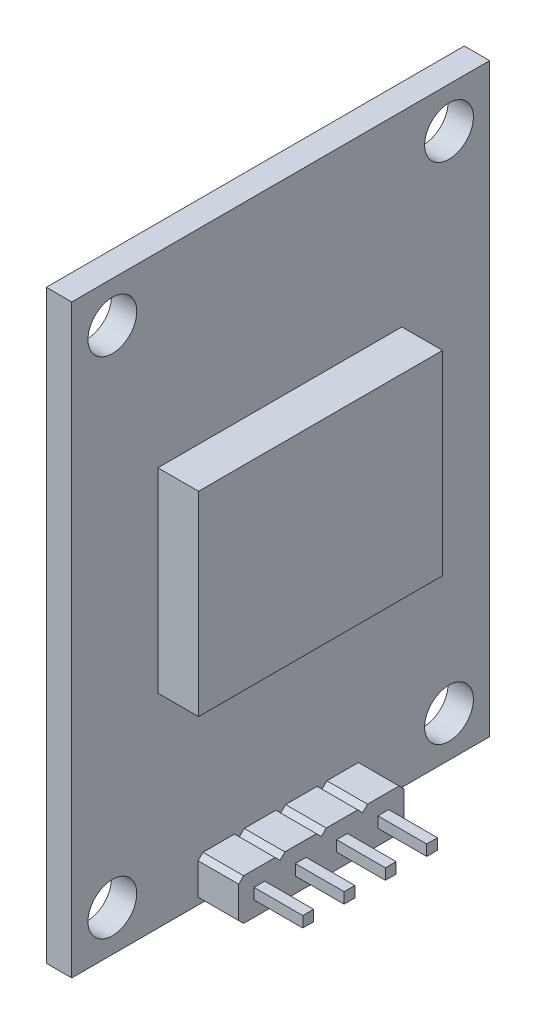
from build123d import *

# Parameters (mm, degrees)
SKETCH_1_W             = 25.7
SKETCH_1_H             = 36
EXTRUDE_1_DEPTH        = 1.56
SKETCH_2_R             = 1.5
CUT_EXTRUDE_1_DEPTH    = 1.56
SKETCH_3_W             = 2.54
SKETCH_3_H             = 2.54
EXTRUDE_2_DEPTH        = 2.5
CHAMFER_1_SIZE         = 0.3
PATTERN_START          = 1.56
PATTERN_LINEAR_1_DEPTH = 2.5
SKETCH_4_W             = 15
SKETCH_4_H             = 12
EXTRUDE_3_DEPTH        = 2.5
SKETCH_5_W             = 0.664657546
SKETCH_5_H             = 0.664657545
EXTRUDE_4_DEPTH        = 3
PATTERN_LINEAR_2_COUNT = 4
PATTERN_LINEAR_2_PITCH = 2.54


# Read off the part's stored shape, not the designer's step: 阵列(线性)1
with BuildPart() as part:
    # 草图1 → 凸台-拉伸1 (new body)
    with BuildSketch(Plane(origin=(0, 0, 0), x_dir=(0, 0, -1), z_dir=(1, 0, 0))):
        Rectangle(SKETCH_1_W, SKETCH_1_H)
    extrude(amount=EXTRUDE_1_DEPTH)

    # 草图2 → 切除-拉伸1 (cut)
    with BuildSketch(Plane(origin=(1.56, 0, 0), x_dir=(0, 0, -1), z_dir=(1, 0, 0))):
        with Locations((-10.35, 15.5)):
            Circle(SKETCH_2_R)
        with Locations((10.35, 15.5)):
            Circle(SKETCH_2_R)
        with Locations((-10.35, -15.5)):
            Circle(SKETCH_2_R)
        with Locations((10.35, -15.5)):
            Circle(SKETCH_2_R)
    extrude(amount=-CUT_EXTRUDE_1_DEPTH, mode=Mode.SUBTRACT)

    # 草图3 → 凸台-拉伸2 (add)
    with BuildSketch(Plane(origin=(1.56, 0, 0), x_dir=(0, 0, -1), z_dir=(1, 0, 0))):
        with Locations((-3.81, -16.609886397)):
            Rectangle(SKETCH_3_W, SKETCH_3_H)
    extrude(amount=EXTRUDE_2_DEPTH)

    # 倒角1
    chamfer_1_edges = [part.edges().sort_by_distance(p)[0] for p in [
        (2.81, -17.879886397, 2.54),
        (2.81, -15.339886397, 2.54),
        (2.81, -15.339886397, 5.08),
        (2.81, -17.879886397, 5.08),
    ]]
    chamfer(chamfer_1_edges, length=CHAMFER_1_SIZE)

    # 阵列(线性)1 outline → 阵列(线性)1 (add)
    with BuildSketch(Plane.YZ.offset(PATTERN_START)):
        Polygon((-15.339886397, 0.3), (-15.339886397, 2.24), (-15.639886397, 2.54), (-17.579886397, 2.54), (-17.879886397, 2.24), (-17.879886397, 0.3), (-17.579886397, 0), (-17.879886397, -0.3), (-17.879886397, -2.24), (-17.579886397, -2.54), (-17.879886397, -2.84), (-17.879886397, -4.78), (-17.579886397, -5.08), (-15.639886397, -5.08), (-15.339886397, -4.78), (-15.339886397, -2.84), (-15.639886397, -2.54), (-15.339886397, -2.24), (-15.339886397, -0.3), (-15.639886397, 0), align=None)
    extrude(amount=PATTERN_LINEAR_1_DEPTH)

    # 草图4 → 凸台-拉伸3 (add)
    with BuildSketch(Plane(origin=(1.56, 0, 0), x_dir=(0, 0, -1), z_dir=(1, 0, 0))):
        with Locations((-0.05, 0.52)):
            Rectangle(SKETCH_4_W, SKETCH_4_H)
    extrude(amount=EXTRUDE_3_DEPTH)

    # 草图5 → 凸台-拉伸4 (add)
    with BuildSketch(Plane(origin=(4.06, 0, 0), x_dir=(0, 0, -1), z_dir=(1, 0, 0))):
        with Locations((-3.81, -16.609886397)):
            Rectangle(SKETCH_5_W, SKETCH_5_H)
    extrude_4 = extrude(amount=EXTRUDE_4_DEPTH)

    # 阵列(线性)2: 凸台-拉伸4 ×4
    with Locations(*[(0, 0, -i * PATTERN_LINEAR_2_PITCH) for i in range(1, PATTERN_LINEAR_2_COUNT)]):
        add(extrude_4)


solid = part.part
